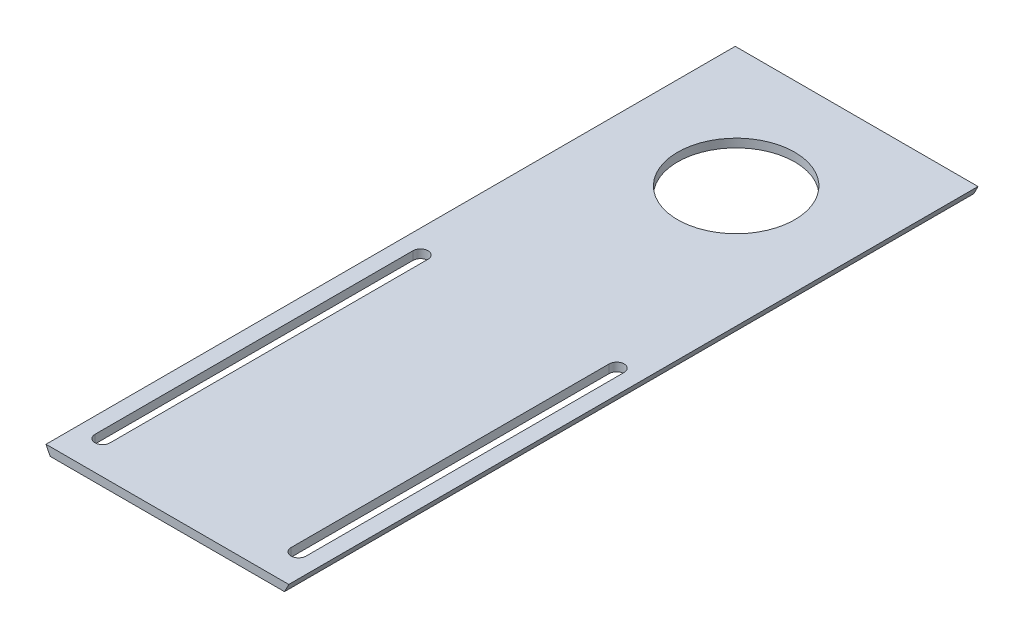
from build123d import *

# Parameters (mm, degrees)
BOSS_EXTRUDE1_DEPTH = 261.62
SKETCH3_R           = 22.225
CUT_EXTRUDE1_DEPTH  = 266.665663227


with BuildPart() as part:
    # Sketch2 → Boss-Extrude1 (new body)
    with BuildSketch(Plane.XY):
        with BuildLine():
            Line((-44.45, -24.593444248), (44.45, -24.593444248))
            ThreePointArc((44.45, -24.593444248), (45.291168316, -23.007609015), (46.075781684, -21.393044248))
            Line((46.075781684, -21.393044248), (-46.075781684, -21.393044248))
            ThreePointArc((-46.075781684, -21.393044248), (-45.291168316, -23.007609015), (-44.45, -24.593444248))
        make_face()
    extrude(amount=BOSS_EXTRUDE1_DEPTH)

    # Sketch3 → Cut-Extrude1 (cut, through all)
    with BuildSketch(Plane.XZ.offset(24.593444248)):
        with Locations((0, 45.72)):
            Circle(SKETCH3_R)
        with BuildLine():
            Line((-40.053517537, 128.317412284), (-40.053517537, 249.024041398))
            ThreePointArc((-40.053517537, 249.024041398), (-37.219693042, 251.857865893), (-34.385868547, 249.024041398))
            Line((-34.385868547, 249.024041398), (-34.385868547, 128.317412284))
            ThreePointArc((-34.385868547, 128.317412284), (-37.219693042, 125.483587789), (-40.053517537, 128.317412284))
        make_face()
        with BuildLine():
            Line((34.385868547, 128.317412284), (34.385868547, 249.024041398))
            ThreePointArc((34.385868547, 249.024041398), (37.219693042, 251.857865893), (40.053517537, 249.024041398))
            Line((40.053517537, 249.024041398), (40.053517537, 128.317412284))
            ThreePointArc((40.053517537, 128.317412284), (37.219693042, 125.483587789), (34.385868547, 128.317412284))
        make_face()
    extrude(amount=-CUT_EXTRUDE1_DEPTH, mode=Mode.SUBTRACT)


solid = part.part
